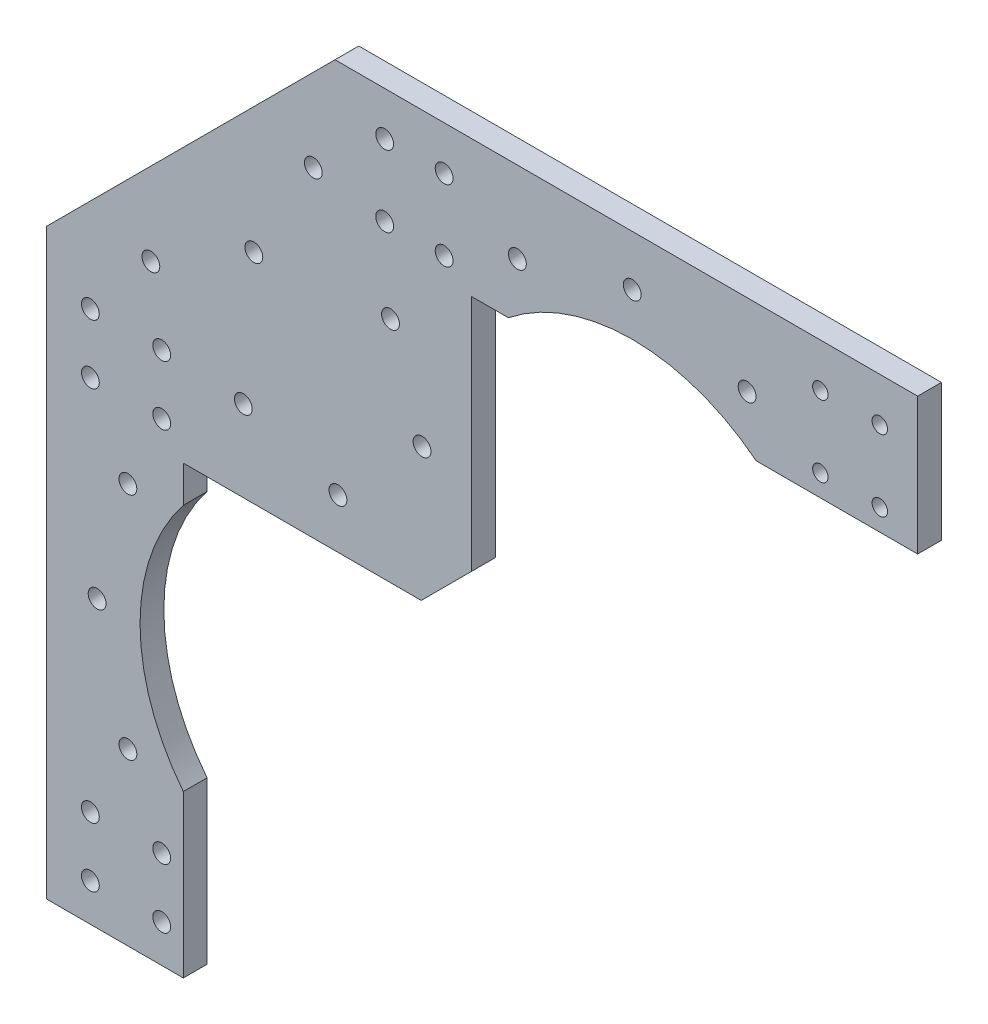
from build123d import *

# Parameters (mm, degrees)
BOSS_EXTRUDE1_DEPTH = 4
SKETCH3_R           = 1.5
SKETCH3_R_2         = 1.3
CUT_EXTRUDE1_DEPTH  = 10
SKETCH4_R           = 1.5
CUT_EXTRUDE2_DEPTH  = 140.357454053


with BuildPart() as part:
    # Sketch1 → Boss-Extrude1 (new body)
    with BuildSketch(Plane.XY):
        with BuildLine():
            Line((-98.5, -48), (-75.5, -48))
            Line((-75.5, -48), (-75.5, -20.842541205))
            ThreePointArc((-75.5, -20.842541205), (-82.779120716, 0), (-75.5, 20.842541205))
            Line((-75.5, 20.842541205), (-75.5, 27))
            Line((-75.5, 27), (-35.485281374, 27))
            Line((-35.485281374, 27), (-27, 35.485281374))
            Line((-27, 35.485281374), (-27, 75.5))
            Line((-27, 75.5), (-20.842541205, 75.5))
            ThreePointArc((-20.842541205, 75.5), (0, 82.779120716), (20.842541205, 75.5))
            Line((20.842541205, 75.5), (48, 75.5))
            Line((48, 75.5), (48, 98.5))
            Line((48, 98.5), (-49.992424049, 98.5))
            Line((-49.992424049, 98.5), (-98.5, 49.992424049))
            Line((-98.5, 49.992424049), (-98.5, -48))
        make_face()
    extrude(amount=BOSS_EXTRUDE1_DEPTH)

    # Sketch3 → Cut-Extrude1 (cut)
    with BuildSketch(Plane.XY.offset(4)):
        with Locations((-91.13513322, -41.635923431)):
            Circle(SKETCH3_R)
        with Locations((-91.13513322, -31.635923431)):
            Circle(SKETCH3_R)
        with Locations((-79.13513322, -31.635923431)):
            Circle(SKETCH3_R)
        with Locations((-79.13513322, -41.635923431)):
            Circle(SKETCH3_R)
        with Locations((-91.13513322, 31.635923431)):
            Circle(SKETCH3_R)
        with Locations((-91.13513322, 41.635923431)):
            Circle(SKETCH3_R)
        with Locations((-79.13513322, 41.635923431)):
            Circle(SKETCH3_R)
        with Locations((-79.13513322, 31.635923431)):
            Circle(SKETCH3_R)
        with Locations((31.635923431, 79.13513322)):
            Circle(SKETCH3_R_2)
        with Locations((31.635923431, 91.13513322)):
            Circle(SKETCH3_R_2)
        with Locations((41.635923431, 91.13513322)):
            Circle(SKETCH3_R_2)
        with Locations((41.635923431, 79.13513322)):
            Circle(SKETCH3_R_2)
        with Locations((-31.635923431, 79.13513322)):
            Circle(SKETCH3_R)
        with Locations((-31.635923431, 91.13513322)):
            Circle(SKETCH3_R)
        with Locations((-41.635923431, 91.13513322)):
            Circle(SKETCH3_R)
        with Locations((-41.635923431, 79.13513322)):
            Circle(SKETCH3_R)
    extrude(amount=-CUT_EXTRUDE1_DEPTH, mode=Mode.SUBTRACT)

    # Sketch4 → Cut-Extrude2 (cut, through all)
    with BuildSketch(Plane.XY.offset(4)):
        with Locations((-90, 0)):
            Circle(SKETCH4_R)
        with Locations((-63.639610307, 63.639610307)):
            Circle(SKETCH4_R)
        with Locations((0, 90)):
            Circle(SKETCH4_R)
        with Locations((-80.960118382, 53.639610307)):
            Circle(SKETCH4_R)
        with Locations((-53.639610307, 80.960118382)):
            Circle(SKETCH4_R)
        with Locations((19.318516526, 84.823619098)):
            Circle(SKETCH4_R)
        with Locations((-19.318516526, 84.823619098)):
            Circle(SKETCH4_R)
        with Locations((-84.823619098, 19.318516526)):
            Circle(SKETCH4_R)
        with Locations((-84.823619098, -19.318516526)):
            Circle(SKETCH4_R)
        with Locations((-40.658639918, 65.40737726)):
            Circle(SKETCH4_R)
        with Locations((-65.40737726, 40.658639918)):
            Circle(SKETCH4_R)
        with Locations((-49.497474683, 35.355339059)):
            Circle(SKETCH4_R)
        with Locations((-35.355339059, 49.497474683)):
            Circle(SKETCH4_R)
    extrude(amount=-CUT_EXTRUDE2_DEPTH, mode=Mode.SUBTRACT)


solid = part.part
